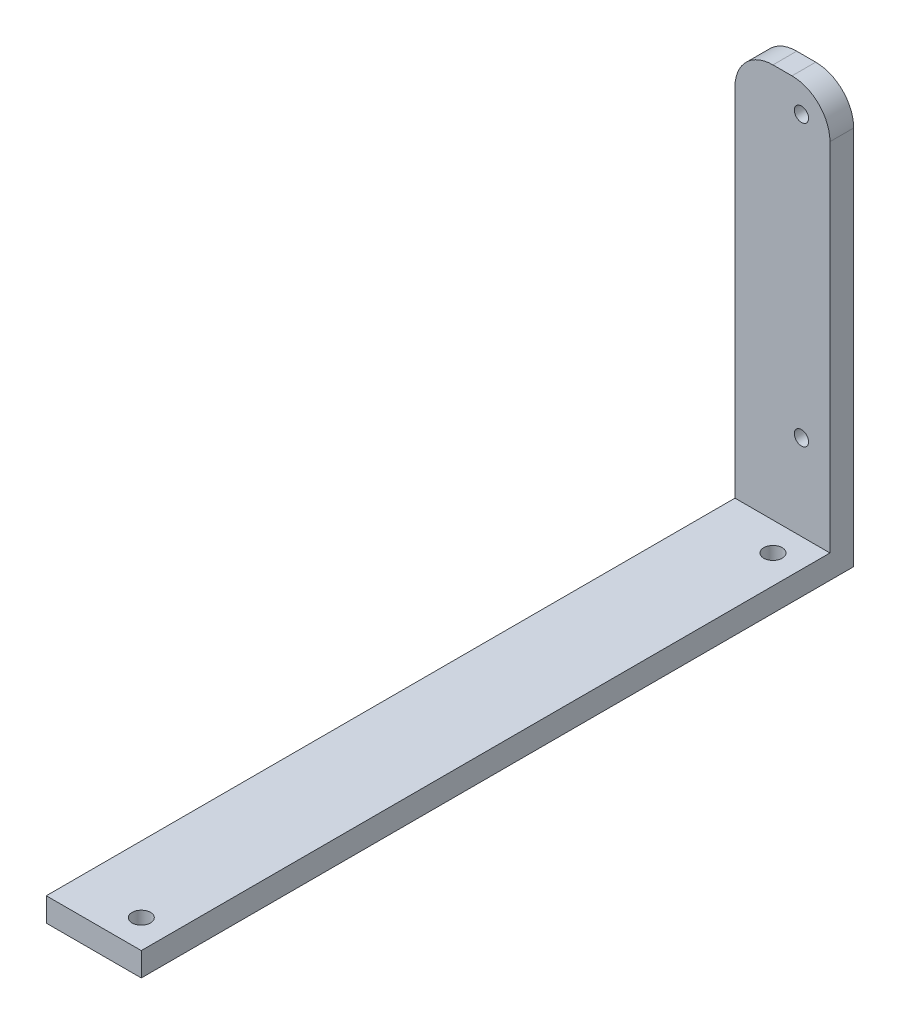
from build123d import *

# Parameters (mm, degrees)
SKETCH1_W           = 20
SKETCH1_H           = 88
SKETCH1_R           = 1.5
BOSS_EXTRUDE1_DEPTH = 5
SKETCH2_W           = 20
SKETCH2_H           = 5
BOSS_EXTRUDE2_DEPTH = 145
FILLET1_R           = 8
SKETCH3_R           = 1.939400698
CUT_EXTRUDE1_DEPTH  = 173.594901431


with BuildPart() as part:
    # Sketch1 → Boss-Extrude1 (new body)
    with BuildSketch(Plane.XY):
        with Locations((10, 44)):
            Rectangle(SKETCH1_W, SKETCH1_H)
        with Locations((14, 82)):
            Circle(SKETCH1_R, mode=Mode.SUBTRACT)
        with Locations((14, 23)):
            Circle(SKETCH1_R, mode=Mode.SUBTRACT)
    extrude(amount=BOSS_EXTRUDE1_DEPTH)

    # Sketch2 → Boss-Extrude2 (add)
    with BuildSketch(Plane.XY.offset(5)):
        with Locations((10, 2.5)):
            Rectangle(SKETCH2_W, SKETCH2_H)
    extrude(amount=BOSS_EXTRUDE2_DEPTH)

    # Fillet1
    fillet1_edges = [part.edges().sort_by_distance(p)[0] for p in [
        (20, 88, 2.5),
        (0, 88, 2.5),
    ]]
    fillet(fillet1_edges, radius=FILLET1_R)

    # Sketch3 → Cut-Extrude1 (cut, through all)
    with BuildSketch(Plane(origin=(0, 5, 0), x_dir=(1, 0, 0), z_dir=(0, 1, 0))):
        with Locations((14, -144)):
            Circle(SKETCH3_R)
        with Locations((14, -11)):
            Circle(SKETCH3_R)
    extrude(amount=-CUT_EXTRUDE1_DEPTH, mode=Mode.SUBTRACT)


solid = part.part
